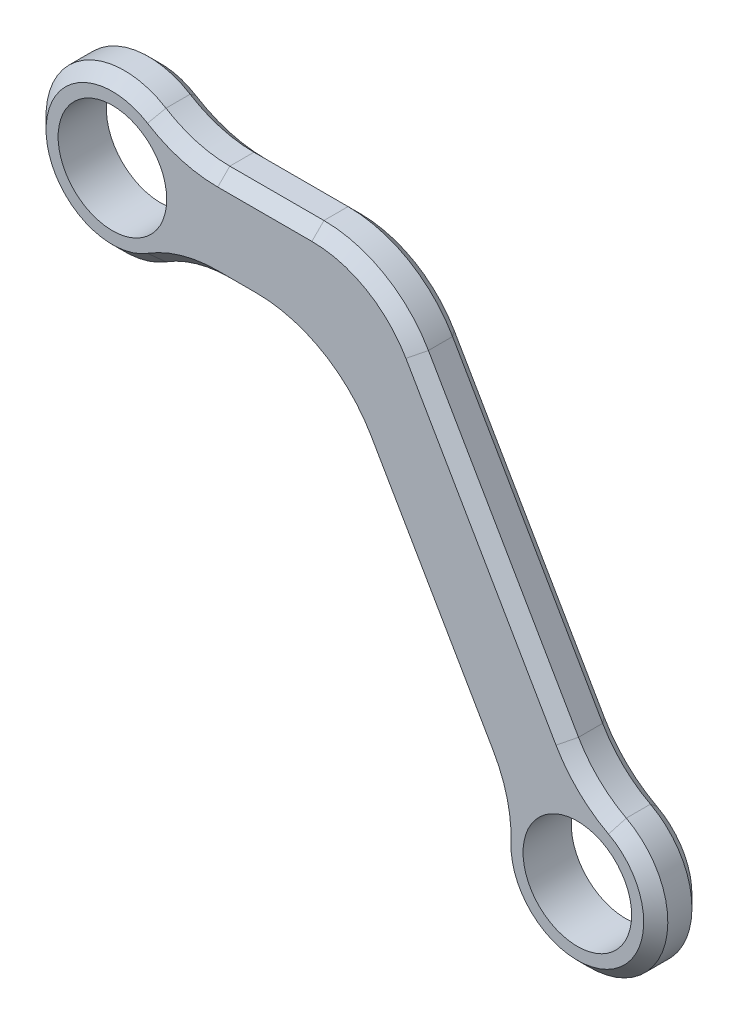
from build123d import *

# Parameters (mm, degrees)
SKETCH1_R           = 4.5
BOSS_EXTRUDE1_DEPTH = 4
FILLET1_R           = 10
CHAMFER2_SIZE       = 1


with BuildPart() as part:
    # Sketch1 → Boss-Extrude1 (new body)
    with BuildSketch(Plane.XY):
        with BuildLine():
            Line((5.123475383, -4), (17.690598923, -4))
            Line((17.690598923, -4), (32.51150124, -29.670555826))
            ThreePointArc((32.51150124, -29.670555826), (41.787340546, -37.736780788), (39.43970447, -25.670555826))
            Line((39.43970447, -25.670555826), (22.309401077, 4))
            Line((22.309401077, 4), (5.123475383, 4))
            ThreePointArc((5.123475383, 4), (-6.5, 0), (5.123475383, -4))
        make_face()
        Circle(SKETCH1_R, mode=Mode.SUBTRACT)
        with Locations((38.537340546, -32.107615664)):
            Circle(SKETCH1_R, mode=Mode.SUBTRACT)
    extrude(amount=BOSS_EXTRUDE1_DEPTH)

    # Fillet1
    fillet1_edges = [part.edges().sort_by_distance(p)[0] for p in [
        (17.690598923, -4, 2),
        (22.309401077, 4, 2),
        (32.51150124, -29.670555826, 2),
        (39.43970447, -25.670555826, 2),
        (5.123475383, -4, 2),
        (5.123475383, 4, 2),
    ]]
    fillet(fillet1_edges, radius=FILLET1_R)

    # Chamfer2
    chamfer2_edges = [part.edges().sort_by_distance(p)[0] for p in [
        (39.346084478, -24.735906793, 4),
        (41.787340546, -37.736780788, 4),
        (31.74888143, -29.122154018, 4),
        (25.642263451, -17.772686966, 4),
        (16.917096231, -5.339745962, 4),
        (10.324610415, -4, 4),
        (5.979715185, -4.386247225, 4),
        (-6.5, 0, 4),
        (5.979715185, 4.386247225, 4),
        (12.634011492, 4, 4),
        (21.535898385, 2.660254038, 4),
        (31.415766143, -11.772686966, 4),
        (16.917096231, -5.339745962, 0),
        (10.324610415, -4, 0),
        (25.642263451, -17.772686966, 0),
        (5.979715185, -4.386247225, 0),
        (31.74888143, -29.122154018, 0),
        (-6.5, 0, 0),
        (41.787340546, -37.736780788, 0),
        (5.979715185, 4.386247225, 0),
        (39.346084478, -24.735906793, 0),
        (12.634011492, 4, 0),
        (31.415766143, -11.772686966, 0),
        (21.535898385, 2.660254038, 0),
    ]]
    chamfer(chamfer2_edges, length=CHAMFER2_SIZE)


solid = part.part
